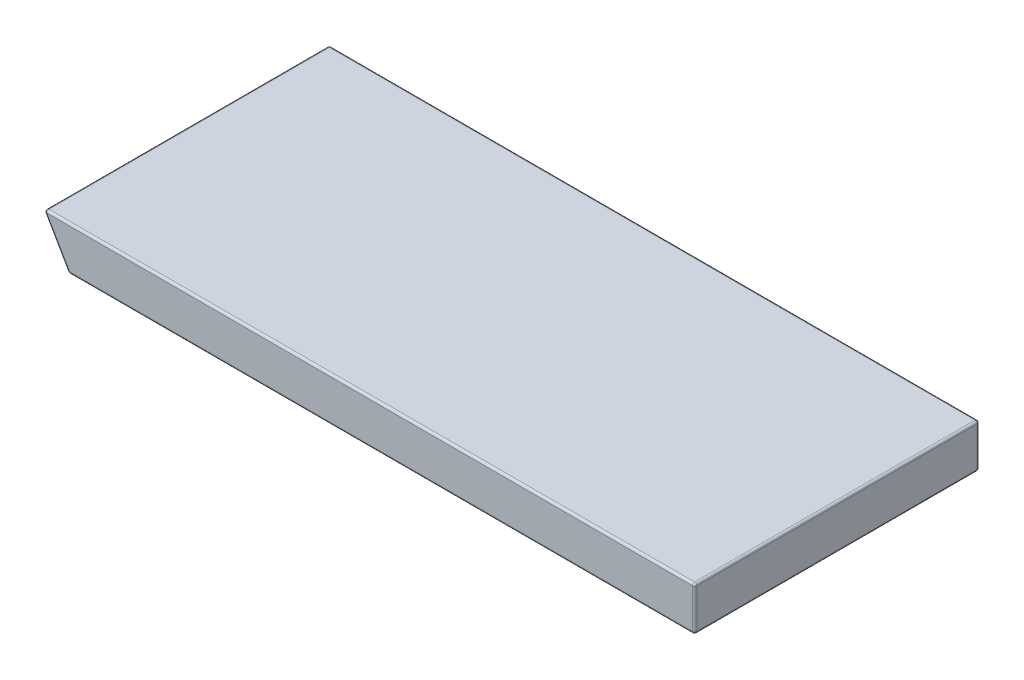
from build123d import *

# Parameters (mm, degrees)
SKETCH1_W          = 154
SKETCH1_H          = 65
BASE_DEPTH         = 10
CUT_EXTRUDE1_DEPTH = 102.262036322
FILLET1_R          = 0.5


with BuildPart() as part:
    # Sketch1 → base (new body)
    with BuildSketch(Plane(origin=(0, 0, 0), x_dir=(1, 0, 0), z_dir=(0, 1, 0))):
        Rectangle(SKETCH1_W, SKETCH1_H)
    extrude(amount=BASE_DEPTH)

    # Sketch5 → Cut-Extrude1 (cut, through all)
    with BuildSketch(Plane.XY.offset(32.5)):
        Polygon((-231.097836483, 285.957841008), (-71.773502692, 10), (-66, 0), (-77, 0), (-395.648667582, 0), (-948.021313627, 317.855868763), (-783.470482528, 603.813709771), align=None)
    extrude(amount=-CUT_EXTRUDE1_DEPTH, mode=Mode.SUBTRACT)

    # Fillet1
    fillet1_edges = [part.edges().sort_by_distance(p)[0] for p in [
        (77, 5, -32.5),
        (77, 5, 32.5),
        (2.613248654, 10, -32.5),
        (2.613248654, 10, 32.5),
        (77, 10, 0),
        (5.5, 0, -32.5),
        (5.5, 0, 32.5),
        (77, 0, 0),
        (-66, 0, 0),
        (-68.886751346, 5, -32.5),
        (-71.773502692, 10, 0),
        (-68.886751346, 5, 32.5),
    ]]
    fillet(fillet1_edges, radius=FILLET1_R)


solid = part.part
